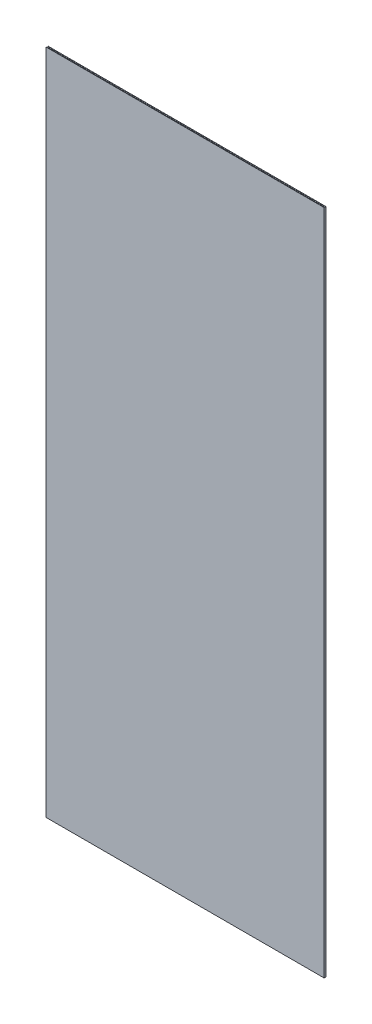
from build123d import *

# Parameters (mm, degrees)
BOSS_EXTRUDE1_DEPTH = 3000
LPATTERN1_COUNT     = 125
LPATTERN1_PITCH     = 10


with BuildPart() as part:
    # Sketch1 → Boss-Extrude1 (new body)
    with BuildSketch(Plane(origin=(0, 0, 0), x_dir=(1, 0, 0), z_dir=(0, 1, 0))):
        Polygon((5, -4), (-5.3, -4), (-5.3, -3.7), (4.7, -3.7), (4.7, 3.7), (-5.3, 3.7), (-5.3, 4), (5, 4), align=None)
    boss_extrude1 = extrude(amount=BOSS_EXTRUDE1_DEPTH)

    # LPattern1: Boss-Extrude1 ×125
    with Locations(*[(i * LPATTERN1_PITCH, 0, 0) for i in range(1, LPATTERN1_COUNT)]):
        add(boss_extrude1)


solid = part.part
